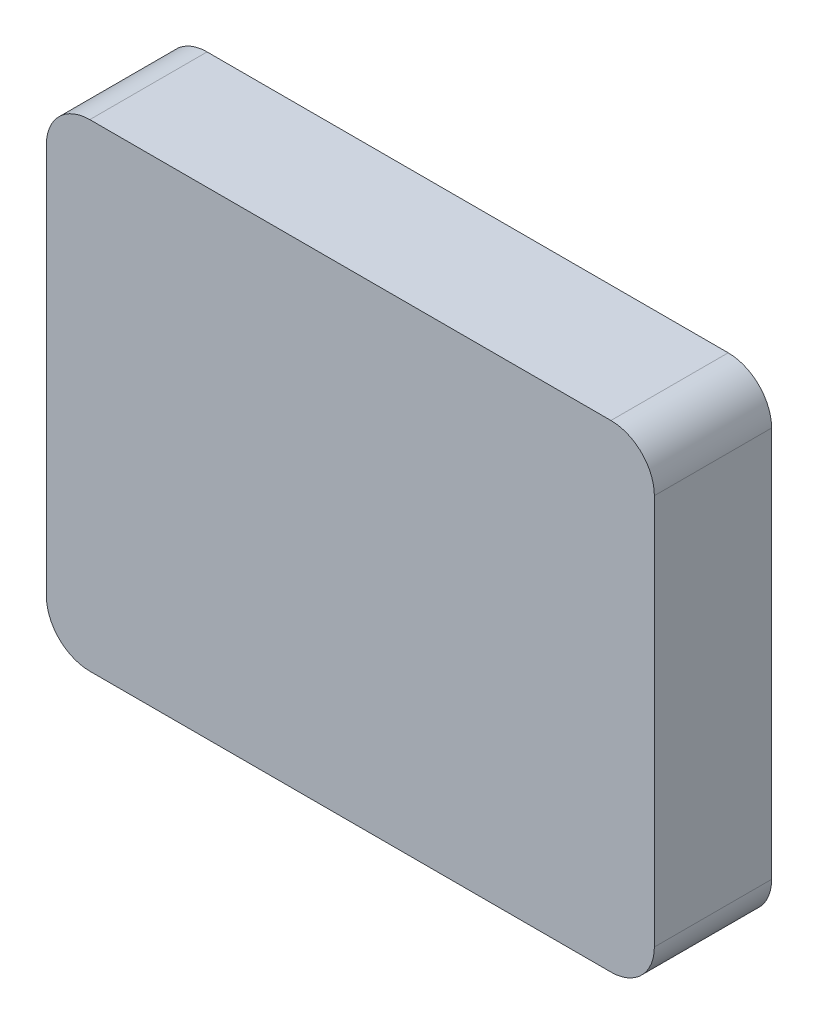
from build123d import *

# Parameters (mm, degrees)
SKETCH1_W                = 140
SKETCH1_H                = 110
BOSS_EXTRUDE1_DEPTH      = 27
FILLET1_R                = 10
CUT_EXTRUDE1_DEPTH       = 25
CUT_EXTRUDE2_DEPTH       = 2
BOSS_EXTRUDE2_START      = 25
BOSS_EXTRUDE2_DEPTH      = 25
FILLET2_R                = 3
M3_CLEARANCE_HOLE1_D     = 3.4
M3_CLEARANCE_HOLE1_DEPTH = 15
M3_CLEARANCE_HOLE1_TIP   = 1.021463052
FILLET3_R                = 3


with BuildPart() as part:
    # Sketch1 → Boss-Extrude1 (new body)
    with BuildSketch(Plane.XY):
        with Locations((-49.99935, 35)):
            Rectangle(SKETCH1_W, SKETCH1_H)
    extrude(amount=BOSS_EXTRUDE1_DEPTH)

    # Fillet1
    fillet1_edges = [part.edges().sort_by_distance(p)[0] for p in [
        (20.00065, -20, 13.5),
        (-119.99935, -20, 13.5),
        (-119.99935, 90, 13.5),
        (20.00065, 90, 13.5),
    ]]
    fillet(fillet1_edges, radius=FILLET1_R)

    # Sketch3 → Cut-Extrude1 (cut)
    with BuildSketch(Plane(origin=(0, 0, 0), x_dir=(-1, 0, 0), z_dir=(0, 0, -1))):
        with BuildLine():
            Line((106.99935, 80), (-7.00065, 80))
            ThreePointArc((-7.00065, 80), (-9.121970344, 79.121320344), (-10.00065, 77))
            Line((-10.00065, 77), (-10.00065, -7))
            ThreePointArc((-10.00065, -7), (-9.121970344, -9.121320344), (-7.00065, -10))
            Line((-7.00065, -10), (106.99935, -10))
            ThreePointArc((106.99935, -10), (109.120670344, -9.121320344), (109.99935, -7))
            Line((109.99935, -7), (109.99935, 77))
            ThreePointArc((109.99935, 77), (109.120670344, 79.121320344), (106.99935, 80))
        make_face()
    extrude(amount=-CUT_EXTRUDE1_DEPTH, mode=Mode.SUBTRACT)

    # Sketch5 → Cut-Extrude2 (cut)
    with BuildSketch(Plane(origin=(0, 0, 0), x_dir=(-1, 0, 0), z_dir=(0, 0, -1))):
        with BuildLine():
            Line((-7.00065, -17), (106.99935, -17))
            ThreePointArc((106.99935, -17), (114.070417812, -14.071067812), (116.99935, -7))
            Line((116.99935, -7), (116.99935, 77))
            ThreePointArc((116.99935, 77), (114.070417812, 84.071067812), (106.99935, 87))
            Line((106.99935, 87), (-7.00065, 87))
            ThreePointArc((-7.00065, 87), (-14.071717812, 84.071067812), (-17.00065, 77))
            Line((-17.00065, 77), (-17.00065, -7))
            ThreePointArc((-17.00065, -7), (-14.071717812, -14.071067812), (-7.00065, -17))
        make_face()
        with BuildLine():
            Line((-7.00065, -13), (106.99935, -13))
            ThreePointArc((106.99935, -13), (111.241990687, -11.242640687), (112.99935, -7))
            Line((112.99935, -7), (112.99935, 77))
            ThreePointArc((112.99935, 77), (111.241990687, 81.242640687), (106.99935, 83))
            Line((106.99935, 83), (-7.00065, 83))
            ThreePointArc((-7.00065, 83), (-11.243290687, 81.242640687), (-13.00065, 77))
            Line((-13.00065, 77), (-13.00065, -7))
            ThreePointArc((-13.00065, -7), (-11.243290687, -11.242640687), (-7.00065, -13))
        make_face(mode=Mode.SUBTRACT)
    extrude(amount=-CUT_EXTRUDE2_DEPTH, mode=Mode.SUBTRACT)

    # Sketch6 → Boss-Extrude2 (add)
    with BuildSketch(Plane(origin=(0, 0, 25), x_dir=(-1, 0, 0), z_dir=(0, 0, -1)).offset(BOSS_EXTRUDE2_START)):
        with BuildLine():
            Line((0.862925656, 70.225224344), (0.862925656, 80))
            Line((0.862925656, 80), (-7.00065, 80))
            ThreePointArc((-7.00065, 80), (-9.121970344, 79.121320344), (-10.00065, 77))
            Line((-10.00065, 77), (-10.00065, 63.225224344))
            Line((-10.00065, 63.225224344), (-6.137074344, 63.225224344))
            ThreePointArc((-6.137074344, 63.225224344), (-1.187326876, 65.275476876), (0.862925656, 70.225224344))
        make_face()
        with BuildLine():
            Line((82.112925656, 70.225224344), (82.112925656, 80))
            Line((82.112925656, 80), (96.112925656, 80))
            Line((96.112925656, 80), (96.112925656, 70.225224344))
            ThreePointArc((96.112925656, 70.225224344), (89.112925656, 63.225224344), (82.112925656, 70.225224344))
        make_face()
        with BuildLine():
            Line((-10.00065, 12.453724344), (-10.00065, -1.546275656))
            Line((-10.00065, -1.546275656), (-10.00065, -7))
            ThreePointArc((-10.00065, -7), (-9.121970344, -9.121320344), (-7.00065, -10))
            Line((-7.00065, -10), (-4.00065, -10))
            Line((-4.00065, -10), (-4.00065, -1.211868999))
            ThreePointArc((-4.00065, -1.211868999), (0.777518707, 6.535585378), (-6.138374344, 12.453724344))
            Line((-6.138374344, 12.453724344), (-10.00065, 12.453724344))
        make_face()
        with BuildLine():
            Line((87.155325656, 12.175923879), (87.155325656, -1.265475191))
            ThreePointArc((87.155325656, -1.265475191), (96.112925656, 5.455224344), (87.155325656, 12.175923879))
        make_face()
        with BuildLine():
            Line((106.99935, 74), (109.99935, 74))
            Line((109.99935, 74), (109.99935, 77))
            ThreePointArc((109.99935, 77), (109.120670344, 79.121320344), (106.99935, 80))
            Line((106.99935, 80), (103.99935, 80))
            Line((103.99935, 80), (103.99935, 77))
            ThreePointArc((103.99935, 77), (104.878029656, 74.878679656), (106.99935, 74))
        make_face()
        with BuildLine():
            Line((103.99935, -7), (103.99935, -10))
            Line((103.99935, -10), (106.99935, -10))
            ThreePointArc((106.99935, -10), (109.120670344, -9.121320344), (109.99935, -7))
            Line((109.99935, -7), (109.99935, -4))
            Line((109.99935, -4), (106.99935, -4))
            ThreePointArc((106.99935, -4), (104.878029656, -4.878679656), (103.99935, -7))
        make_face()
    extrude(amount=-BOSS_EXTRUDE2_DEPTH)

    # Fillet2
    fillet2_edges = [part.edges().sort_by_distance(p)[0] for p in [
        (-0.862925656, 80, 12.5),
        (10.00065, 63.225224344, 12.5),
        (-96.112925656, 80, 12.5),
        (-82.112925656, 80, 12.5),
        (4.00065, -1.211868999, 12.5),
        (10.00065, 12.453724344, 12.5),
    ]]
    fillet(fillet2_edges, radius=FILLET2_R)

    # M3 Clearance Hole1
    with Locations(Plane(origin=(0, 0, 0), x_dir=(-1, 0, 0), z_dir=(0, 0, -1))):
        with Locations((-6.137074344, 70.225224344), (89.112925656, 70.225224344), (89.112925656, 5.455224344), (-6.138374344, 5.453724344), (-7.00065, 77), (106.99935, 77), (106.99935, -7), (-7.00065, -7)):
            Hole(M3_CLEARANCE_HOLE1_D / 2, depth=M3_CLEARANCE_HOLE1_DEPTH)
            with Locations((0, 0, -(M3_CLEARANCE_HOLE1_DEPTH + M3_CLEARANCE_HOLE1_TIP / 2))):  # 118° drill point
                Cone(0, M3_CLEARANCE_HOLE1_D / 2, M3_CLEARANCE_HOLE1_TIP, mode=Mode.SUBTRACT)

    # Fillet3
    fillet3_edges = [part.edges().sort_by_distance(p)[0] for p in [
        (-109.99935, 74, 12.5),
        (-103.99935, 80, 12.5),
        (-109.99935, -4, 12.5),
        (-103.99935, -10, 12.5),
        (4.00065, -10, 12.5),
    ]]
    fillet(fillet3_edges, radius=FILLET3_R - 0.0001)  # a hair under: the kernel refuses the full size


solid = part.part
